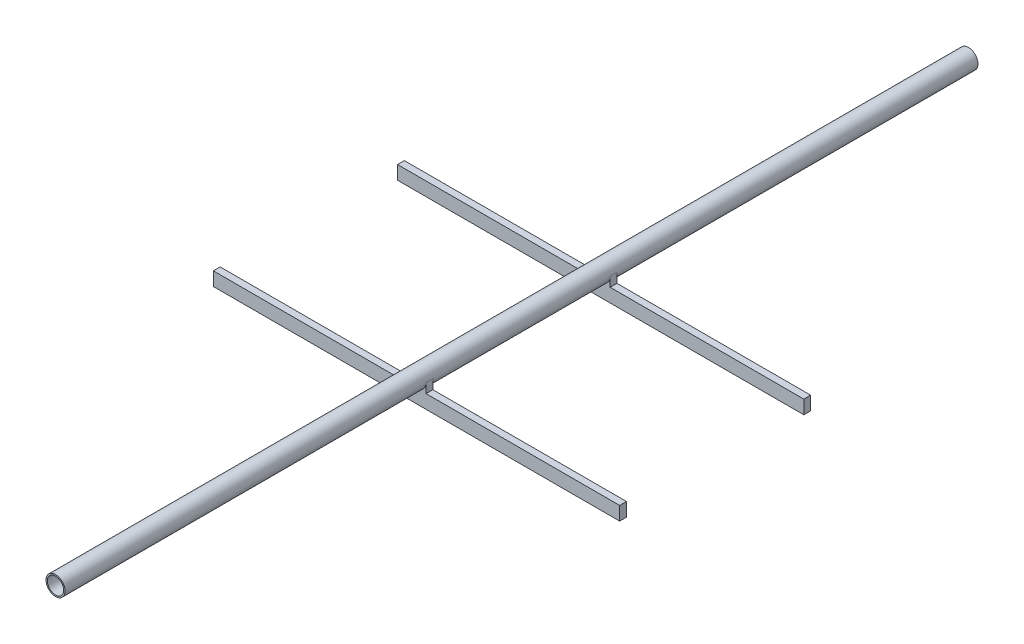
from build123d import *

# Parameters (mm, degrees)
BOSS_EXTRUDE1_DEPTH      = 335.28
BOSS_EXTRUDE1_DEPTH_BACK = 335.28
SKETCH1_R                = 7
SKETCH1_R_2              = 6
SKETCH3_W                = 298.43
SKETCH3_H                = 5
BOSS_EXTRUDE2_DEPTH      = 10
BOSS_EXTRUDE3_START      = -70.13
BOSS_EXTRUDE3_DEPTH      = 5


with BuildPart() as part:
    # Sketch1 → Boss-Extrude1 (new, two sides: drawn at the far end of the back side and taken through both)
    with BuildSketch(Plane.XY.offset(-BOSS_EXTRUDE1_DEPTH_BACK)):
        Circle(SKETCH1_R)
        Circle(SKETCH1_R_2, mode=Mode.SUBTRACT)
    extrude(amount=BOSS_EXTRUDE1_DEPTH + BOSS_EXTRUDE1_DEPTH_BACK)



with BuildPart() as body_2:
    # Sketch3 → Boss-Extrude2 (new body)
    with BuildSketch(Plane(origin=(0, -7, 0), x_dir=(1, 0, 0), z_dir=(0, 1, 0))):
        with Locations((0, 67.63)):
            Rectangle(SKETCH3_W, SKETCH3_H)
    boss_extrude2 = extrude(amount=-BOSS_EXTRUDE2_DEPTH)


with BuildPart() as part_1:
    add(part.part)

    add(body_2.part)  # Boss-Extrude3 merges body 2
    # Boss-Extrude3: read off the stored shape, not the designer's step
    # Boss-Extrude3 outline → Boss-Extrude3 (add)
    with BuildSketch(Plane.XY.offset(BOSS_EXTRUDE3_START)):
        with BuildLine():
            Line((7, -7), (7, 0))
            ThreePointArc((7, 0), (4.94974746, -4.949747477), (-2.4e-08, -7))
            Line((-2.4e-08, -7), (7, -7))
        make_face()
        with BuildLine():
            ThreePointArc((-2.4e-08, -7), (-4.949747477, -4.94974746), (-7, 0))
            Line((-7, 0), (-7, -7))
            Line((-7, -7), (-2.4e-08, -7))
        make_face()
    boss_extrude3 = extrude(amount=BOSS_EXTRUDE3_DEPTH)

    # Mirror12: Boss-Extrude2, Boss-Extrude3 across plane
    add(boss_extrude2.mirror(Plane.XY))
    add(boss_extrude3.mirror(Plane.XY))


solid = part_1.part
